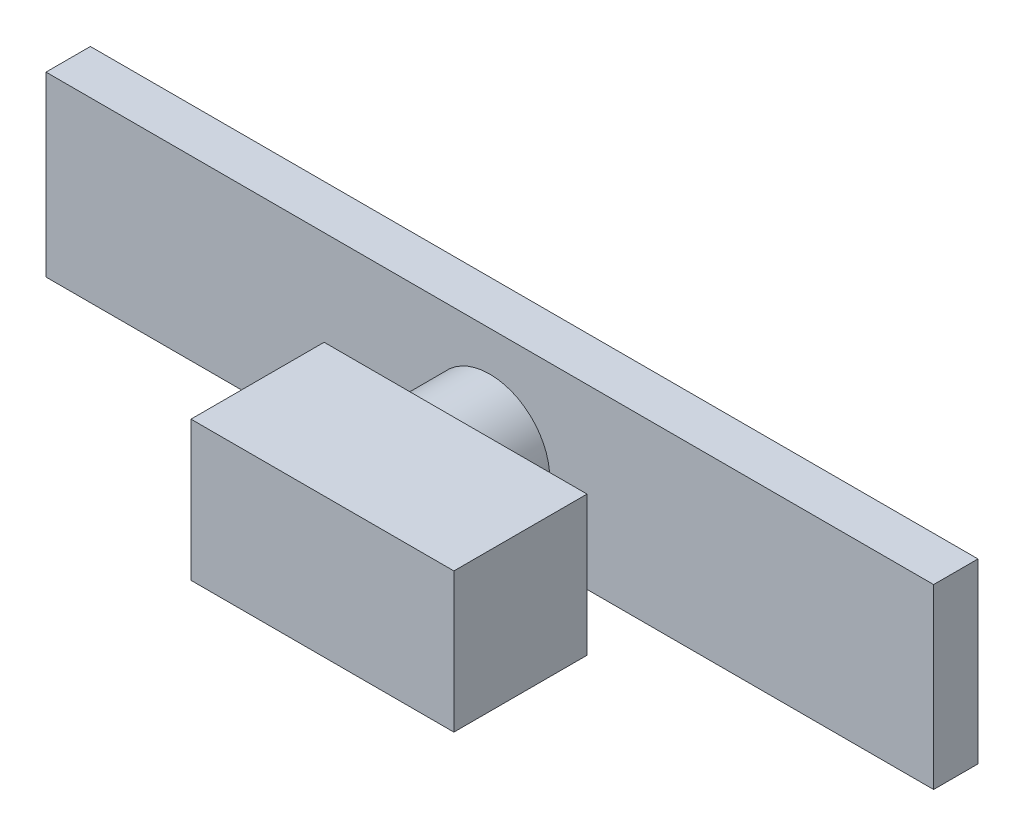
from build123d import *

# Parameters (mm, degrees)
SKETCH2_W           = 254
SKETCH2_H           = 12.7
BOSS_EXTRUDE1_DEPTH = 50.8
SKETCH3_R           = 17.140791438
BOSS_EXTRUDE2_DEPTH = 19.05
SKETCH4_W           = 75.235944222
SKETCH4_H           = 39.955088207
BOSS_EXTRUDE3_DEPTH = 38.1
SCALE2_SCALE        = 0.06
ROTATE_ANGLE        = 90
SCALE5_SCALE        = 0.25
SCALE6_SCALE        = 0.25


with BuildPart() as part:
    # Sketch2 → Boss-Extrude1 (new body)
    with BuildSketch(Plane.XY):
        with Locations((79.130769231, 14.898076923)):
            Rectangle(SKETCH2_W, SKETCH2_H)
    extrude(amount=BOSS_EXTRUDE1_DEPTH)

    # Sketch3 → Boss-Extrude2 (add)
    with BuildSketch(Plane(origin=(0, 21.248076923, 0), x_dir=(1, 0, 0), z_dir=(0, 1, 0))):
        with Locations((79.130769231, -28.483063876)):
            Circle(SKETCH3_R)
    extrude(amount=BOSS_EXTRUDE2_DEPTH)

    # Sketch4 → Boss-Extrude3 (add)
    with BuildSketch(Plane(origin=(0, 40.298076923, 0), x_dir=(1, 0, 0), z_dir=(0, 1, 0))):
        with Locations((88.38546847, -28.088530296)):
            Rectangle(SKETCH4_W, SKETCH4_H)
    extrude(amount=BOSS_EXTRUDE3_DEPTH)


with BuildPart() as part_1:
    # Scale2: scaled about (82.711857342, 33.041003565, 26.623476887)
    add(part.part.scale(SCALE2_SCALE).moved(Location((77.749145901, 31.058543351, 25.026068274))))


with BuildPart() as part_2:
    # rotate: moved
    add(part_1.part.rotate(Axis((0, 33.666927966, 26.550068274), (1, 0, 0)), ROTATE_ANGLE))


with BuildPart() as part_3:
    # Scale5: scaled about (82.711857342, 33.593519353, 25.924143873)
    add(part_2.part.scale(SCALE5_SCALE).moved(Location((62.033893007, 25.195139515, 19.443107905))))


with BuildPart() as part_4:
    # Move Body 4 x: moved
    add(part_3.part.moved(Location((-101.6, 0, 0))))


with BuildPart() as part_5:
    # Move Body 2 y: moved
    add(part_4.part.moved(Location((0, -50.8, 0))))


with BuildPart() as part_6:
    # Scale6: scaled about (-18.888142658, -17.206480647, 25.924143873)
    add(part_5.part.scale(SCALE6_SCALE).moved(Location((-14.166106993, -12.904860485, 19.443107905))))


with BuildPart() as part_7:
    # Move Body 2.1z: moved
    add(part_6.part.moved(Location((0, 0, -30.48))))


solid = part_7.part
